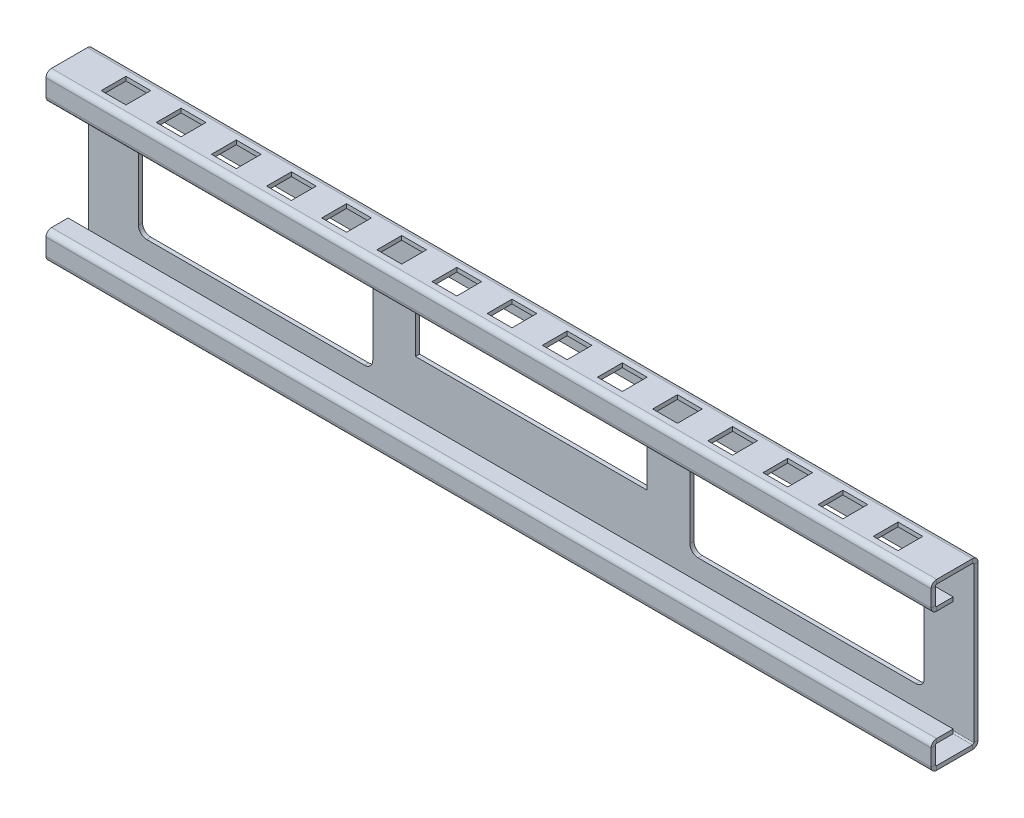
from build123d import *

# Parameters (mm, degrees)
SKETCH_1_W                         = 321
SKETCH_1_H                         = 60
SM_BASE_FLANGE_1_DEPTH             = 1.5
SM_EDGE_FLANGE_1_STRIP_W           = 7
SM_EDGE_FLANGE_1_STRIP_H           = 1.5
SM_EDGE_FLANGE_1_STRIP_CUT_DEPTH   = 321
SM_EDGE_FLANGE_1_STRIP_2_W         = 7
SM_EDGE_FLANGE_1_STRIP_2_H         = 1.5
SM_EDGE_FLANGE_1_STRIP_CUT_2_DEPTH = 321
SM_EDGE_FLANGE_1_DEPTH             = 321
SM_EDGE_FLANGE_1_BEND_DEPTH        = 321
SM_EDGE_FLANGE_2_STRIP_W           = 7
SM_EDGE_FLANGE_2_STRIP_H           = 1.5
SM_EDGE_FLANGE_2_STRIP_CUT_DEPTH   = 321
SM_EDGE_FLANGE_2_STRIP_2_W         = 7
SM_EDGE_FLANGE_2_STRIP_2_H         = 1.5
SM_EDGE_FLANGE_2_STRIP_CUT_2_DEPTH = 321
SM_EDGE_FLANGE_2_DEPTH             = 321
SM_EDGE_FLANGE_2_BEND_DEPTH        = 321
CUT_EXTRUDE_1_DEPTH                = 10
PATTERN_LINEAR_1_COUNT             = 2
PATTERN_LINEAR_1_PITCH             = 100
PATTERN_LINEAR_1_COL_COUNT         = 2
PATTERN_LINEAR_1_COL_PITCH         = 100
SKETCH_19_W                        = 9
SKETCH_19_H                        = 9
CUT_EXTRUDE_2_DEPTH                = 173.04795843
PATTERN_LINEAR_2_COUNT             = 8
PATTERN_LINEAR_2_PITCH             = 20
PATTERN_LINEAR_2_COL_COUNT         = 8
PATTERN_LINEAR_2_COL_PITCH         = 20
SM_EDGE_FLANGE_3_STRIP_W           = 7
SM_EDGE_FLANGE_3_STRIP_H           = 1.5
SM_EDGE_FLANGE_3_STRIP_CUT_DEPTH   = 321
SM_EDGE_FLANGE_3_STRIP_2_W         = 7
SM_EDGE_FLANGE_3_STRIP_2_H         = 1.5
SM_EDGE_FLANGE_3_STRIP_CUT_2_DEPTH = 321
SM_EDGE_FLANGE_3_DEPTH             = 321
SM_EDGE_FLANGE_3_BEND_DEPTH        = 321
EXTRUDE_1_DEPTH                    = 1.5
SKETCH_27_W                        = 84
SKETCH_27_H                        = 31
CUT_EXTRUDE_3_DEPTH                = 6


# Sheet-metal steps are written as plain solids
with BuildPart() as part:
    # Sketch 1 → 基体-法兰1 (new body)
    with BuildSketch(Plane.XY):
        Rectangle(SKETCH_1_W, SKETCH_1_H)
    extrude(amount=-SM_BASE_FLANGE_1_DEPTH)

    # 边线-法兰1 strip (across the edge) → 边线-法兰1 strip cut (cut)
    with BuildSketch(Plane(origin=(160.5, 30, 0), x_dir=(0, -1, 0), z_dir=(-1, 0, 0))):
        with Locations((-1.5, -0.75)):
            Rectangle(SM_EDGE_FLANGE_1_STRIP_W, SM_EDGE_FLANGE_1_STRIP_H)
    extrude(amount=SM_EDGE_FLANGE_1_STRIP_CUT_DEPTH, mode=Mode.SUBTRACT)

    # 边线-法兰1 strip 2 (across the edge) → 边线-法兰1 strip cut 2 (cut)
    with BuildSketch(Plane(origin=(-160.5, -30, 0), x_dir=(0, 1, 0), z_dir=(1, 0, 0))):
        with Locations((-1.5, -0.75)):
            Rectangle(SM_EDGE_FLANGE_1_STRIP_2_W, SM_EDGE_FLANGE_1_STRIP_2_H)
    extrude(amount=SM_EDGE_FLANGE_1_STRIP_CUT_2_DEPTH, mode=Mode.SUBTRACT)

    # 边线-法兰1 section (across the edge) → 边线-法兰1 (add)
    with BuildSketch(Plane(origin=(160.5, 30, 0), x_dir=(0, -1, 0), z_dir=(-1, 0, 0))):
        with BuildLine():
            Line((0, 0.5), (0, 15.5))
            Line((0, 15.5), (1.5, 15.5))
            Line((1.5, 15.5), (1.5, 0.5))
            ThreePointArc((1.5, 0.5), (1.646446609, 0.146446609), (2, 0))
            Line((2, 0), (2, -1.5))
            ThreePointArc((2, -1.5), (0.585786438, -0.914213562), (0, 0.5))
        make_face()
    extrude(amount=SM_EDGE_FLANGE_1_DEPTH)

    # 边线-法兰1 section 2 (across the edge) → 边线-法兰1 bend (add)
    with BuildSketch(Plane(origin=(-160.5, -30, 0), x_dir=(0, 1, 0), z_dir=(1, 0, 0))):
        with BuildLine():
            Line((0, 0.5), (0, 15.5))
            Line((0, 15.5), (1.5, 15.5))
            Line((1.5, 15.5), (1.5, 0.5))
            ThreePointArc((1.5, 0.5), (1.646446609, 0.146446609), (2, 0))
            Line((2, 0), (2, -1.5))
            ThreePointArc((2, -1.5), (0.585786438, -0.914213562), (0, 0.5))
        make_face()
    extrude(amount=SM_EDGE_FLANGE_1_BEND_DEPTH)

    # 边线-法兰2 strip (across the edge) → 边线-法兰2 strip cut (cut)
    with BuildSketch(Plane(origin=(160.5, 28.5, 15.5), x_dir=(0, 0, -1), z_dir=(-1, 0, 0))):
        with Locations((-1.5, -0.75)):
            Rectangle(SM_EDGE_FLANGE_2_STRIP_W, SM_EDGE_FLANGE_2_STRIP_H)
    extrude(amount=SM_EDGE_FLANGE_2_STRIP_CUT_DEPTH, mode=Mode.SUBTRACT)

    # 边线-法兰2 strip 2 (across the edge) → 边线-法兰2 strip cut 2 (cut)
    with BuildSketch(Plane(origin=(-160.5, -28.5, 15.5), x_dir=(0, 0, -1), z_dir=(1, 0, 0))):
        with Locations((-1.5, -0.75)):
            Rectangle(SM_EDGE_FLANGE_2_STRIP_2_W, SM_EDGE_FLANGE_2_STRIP_2_H)
    extrude(amount=SM_EDGE_FLANGE_2_STRIP_CUT_2_DEPTH, mode=Mode.SUBTRACT)

    # 边线-法兰2 section (across the edge) → 边线-法兰2 (add)
    with BuildSketch(Plane(origin=(160.5, 28.5, 15.5), x_dir=(0, 0, -1), z_dir=(-1, 0, 0))):
        with BuildLine():
            Line((0, 0.5), (0, 8.5))
            Line((0, 8.5), (1.5, 8.5))
            Line((1.5, 8.5), (1.5, 0.5))
            ThreePointArc((1.5, 0.5), (1.646446609, 0.146446609), (2, 0))
            Line((2, 0), (2, -1.5))
            ThreePointArc((2, -1.5), (0.585786438, -0.914213562), (0, 0.5))
        make_face()
    extrude(amount=SM_EDGE_FLANGE_2_DEPTH)

    # 边线-法兰2 section 2 (across the edge) → 边线-法兰2 bend (add)
    with BuildSketch(Plane(origin=(-160.5, -28.5, 15.5), x_dir=(0, 0, -1), z_dir=(1, 0, 0))):
        with BuildLine():
            Line((0, 0.5), (0, 8.5))
            Line((0, 8.5), (1.5, 8.5))
            Line((1.5, 8.5), (1.5, 0.5))
            ThreePointArc((1.5, 0.5), (1.646446609, 0.146446609), (2, 0))
            Line((2, 0), (2, -1.5))
            ThreePointArc((2, -1.5), (0.585786438, -0.914213562), (0, 0.5))
        make_face()
    extrude(amount=SM_EDGE_FLANGE_2_BEND_DEPTH)

    # 草图18 → 切除-拉伸1 (cut)
    with BuildSketch(Plane(origin=(0, 0, -1.5), x_dir=(-1, 0, 0), z_dir=(0, 0, -1))):
        with BuildLine():
            Line((-39.5, 20), (39.5, 20))
            ThreePointArc((39.5, 20), (41.621320344, 19.121320344), (42.5, 17))
            Line((42.5, 17), (42.5, -17))
            ThreePointArc((42.5, -17), (41.621320344, -19.121320344), (39.5, -20))
            Line((39.5, -20), (-39.5, -20))
            ThreePointArc((-39.5, -20), (-41.621320344, -19.121320344), (-42.5, -17))
            Line((-42.5, -17), (-42.5, 17))
            ThreePointArc((-42.5, 17), (-41.621320344, 19.121320344), (-39.5, 20))
        make_face()
    cut_extrude_1 = extrude(amount=-CUT_EXTRUDE_1_DEPTH, mode=Mode.SUBTRACT)

    # 阵列(线性)1: 切除-拉伸1 ×2
    with Locations(*[(-i * PATTERN_LINEAR_1_PITCH, 0, 0) for i in range(1, PATTERN_LINEAR_1_COUNT)]):
        add(cut_extrude_1, mode=Mode.SUBTRACT)

    # 阵列(线性)1 col: 切除-拉伸1 ×2
    with Locations(*[(i * PATTERN_LINEAR_1_COL_PITCH, 0, 0) for i in range(1, PATTERN_LINEAR_1_COL_COUNT)]):
        add(cut_extrude_1, mode=Mode.SUBTRACT)

    # 草图19 → 切除-拉伸2 (cut, through all)
    with BuildSketch(Plane(origin=(0, 30, 0), x_dir=(1, 0, 0), z_dir=(0, 1, 0))):
        with Locations((0, -7)):
            Rectangle(SKETCH_19_W, SKETCH_19_H)
    cut_extrude_2 = extrude(amount=-CUT_EXTRUDE_2_DEPTH, mode=Mode.SUBTRACT)

    # 阵列(线性)2: 切除-拉伸2 ×8
    with Locations(*[(-i * PATTERN_LINEAR_2_PITCH, 0, 0) for i in range(1, PATTERN_LINEAR_2_COUNT)]):
        add(cut_extrude_2, mode=Mode.SUBTRACT)

    # 阵列(线性)2 col: 切除-拉伸2 ×8
    with Locations(*[(i * PATTERN_LINEAR_2_COL_PITCH, 0, 0) for i in range(1, PATTERN_LINEAR_2_COL_COUNT)]):
        add(cut_extrude_2, mode=Mode.SUBTRACT)

    # 边线-法兰3 strip (across the edge) → 边线-法兰3 strip cut (cut)
    with BuildSketch(Plane(origin=(-160.5, -20, 14), x_dir=(0, -1, 0), z_dir=(1, 0, 0))):
        with Locations((-1.5, -0.75)):
            Rectangle(SM_EDGE_FLANGE_3_STRIP_W, SM_EDGE_FLANGE_3_STRIP_H)
    extrude(amount=SM_EDGE_FLANGE_3_STRIP_CUT_DEPTH, mode=Mode.SUBTRACT)

    # 边线-法兰3 strip 2 (across the edge) → 边线-法兰3 strip cut 2 (cut)
    with BuildSketch(Plane(origin=(160.5, 20, 14), x_dir=(0, 1, 0), z_dir=(-1, 0, 0))):
        with Locations((-1.5, -0.75)):
            Rectangle(SM_EDGE_FLANGE_3_STRIP_2_W, SM_EDGE_FLANGE_3_STRIP_2_H)
    extrude(amount=SM_EDGE_FLANGE_3_STRIP_CUT_2_DEPTH, mode=Mode.SUBTRACT)

    # 边线-法兰3 section (across the edge) → 边线-法兰3 (add)
    with BuildSketch(Plane(origin=(-160.5, -20, 14), x_dir=(0, -1, 0), z_dir=(1, 0, 0))):
        with BuildLine():
            Line((0, 0.5), (0, 6.5))
            Line((0, 6.5), (1.5, 6.5))
            Line((1.5, 6.5), (1.5, 0.5))
            ThreePointArc((1.5, 0.5), (1.646446609, 0.146446609), (2, 0))
            Line((2, 0), (2, -1.5))
            ThreePointArc((2, -1.5), (0.585786438, -0.914213562), (0, 0.5))
        make_face()
    extrude(amount=SM_EDGE_FLANGE_3_DEPTH)

    # 边线-法兰3 section 2 (across the edge) → 边线-法兰3 bend (add)
    with BuildSketch(Plane(origin=(160.5, 20, 14), x_dir=(0, 1, 0), z_dir=(-1, 0, 0))):
        with BuildLine():
            Line((0, 0.5), (0, 6.5))
            Line((0, 6.5), (1.5, 6.5))
            Line((1.5, 6.5), (1.5, 0.5))
            ThreePointArc((1.5, 0.5), (1.646446609, 0.146446609), (2, 0))
            Line((2, 0), (2, -1.5))
            ThreePointArc((2, -1.5), (0.585786438, -0.914213562), (0, 0.5))
        make_face()
    extrude(amount=SM_EDGE_FLANGE_3_BEND_DEPTH)

    # 草图26 → 凸台-拉伸1 (add)
    with BuildSketch(Plane(origin=(0, 0, -1.5), x_dir=(-1, 0, 0), z_dir=(0, 0, -1))):
        with BuildLine():
            Line((42.5, -17), (42.5, 17))
            ThreePointArc((42.5, 17), (41.621320344, 19.121320344), (39.5, 20))
            Line((39.5, 20), (-39.5, 20))
            ThreePointArc((-39.5, 20), (-41.621320344, 19.121320344), (-42.5, 17))
            Line((-42.5, 17), (-42.5, -17))
            ThreePointArc((-42.5, -17), (-41.621320344, -19.121320344), (-39.5, -20))
            Line((-39.5, -20), (39.5, -20))
            ThreePointArc((39.5, -20), (41.621320344, -19.121320344), (42.5, -17))
        make_face()
    extrude(amount=-EXTRUDE_1_DEPTH)

    # 草图27 → 切除-拉伸3 (cut)
    with BuildSketch(Plane(origin=(0, 0, -1.5), x_dir=(-1, 0, 0), z_dir=(0, 0, -1))):
        with Locations((0, 7.5)):
            Rectangle(SKETCH_27_W, SKETCH_27_H)
    extrude(amount=-CUT_EXTRUDE_3_DEPTH, mode=Mode.SUBTRACT)


solid = part.part
